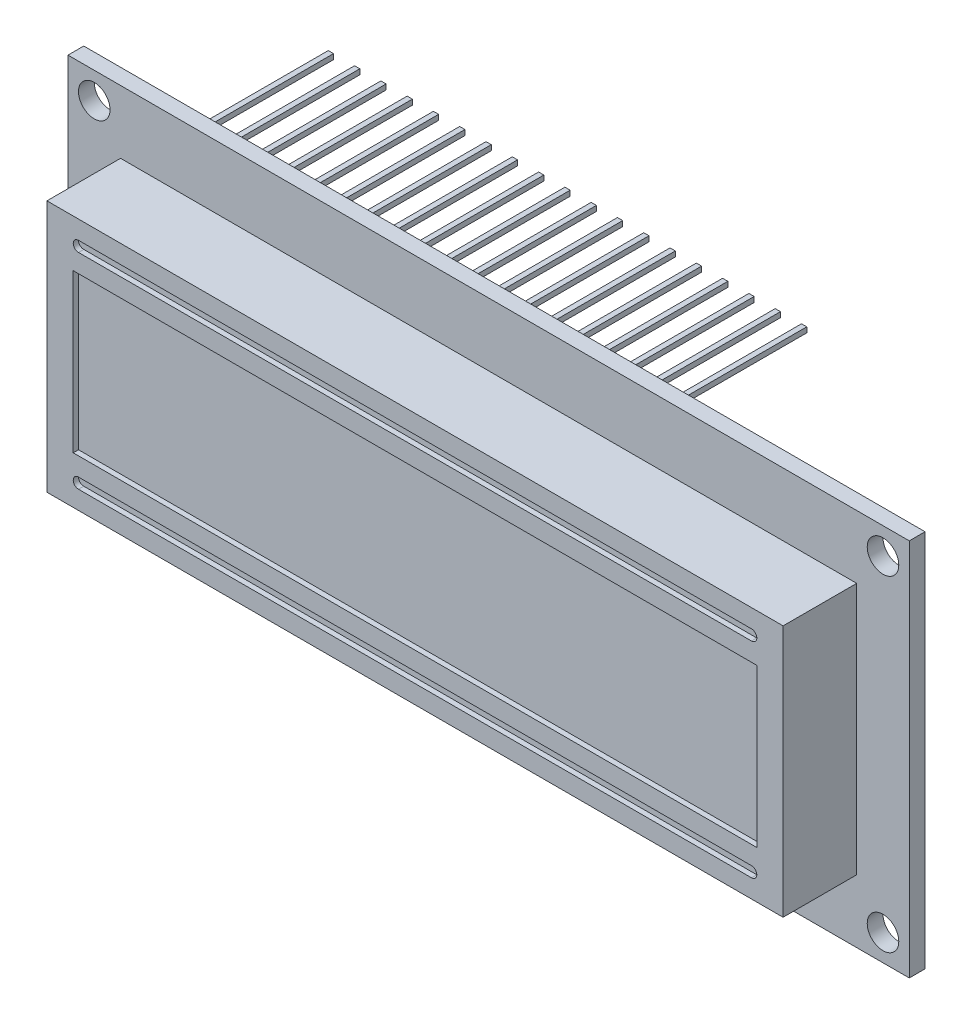
from build123d import *

# Parameters (mm, degrees)
SKETCH1_W           = 80
SKETCH1_H           = 36
BASE_FLANGE1_DEPTH  = 1.5
SKETCH6_W           = 70
SKETCH6_H           = 24
BOSS_EXTRUDE1_DEPTH = 7
SKETCH7_W           = 65
SKETCH7_H           = 15
CUT_EXTRUDE1_DEPTH  = 0.5
CUT_EXTRUDE2_DEPTH  = 0.5
CUT_EXTRUDE3_REACH  = 46.679
SKETCH9_R           = 1.5
SKETCH10_W          = 48
SKETCH10_H          = 2
BOSS_EXTRUDE2_DEPTH = 2
SKETCH11_W          = 0.5
SKETCH11_H          = 0.5
BOSS_EXTRUDE3_DEPTH = 12
LPATTERN1_COUNT     = 19
LPATTERN1_PITCH     = 2.5


# Sheet-metal steps are written as plain solids
with BuildPart() as part:
    # Sketch1 → Base-Flange1 (new body)
    with BuildSketch(Plane.XY):
        Rectangle(SKETCH1_W, SKETCH1_H)
    extrude(amount=-BASE_FLANGE1_DEPTH)

    # Sketch6 → Boss-Extrude1 (add)
    with BuildSketch(Plane.XY):
        Rectangle(SKETCH6_W, SKETCH6_H)
    extrude(amount=BOSS_EXTRUDE1_DEPTH)

    # Sketch7 → Cut-Extrude1 (cut)
    with BuildSketch(Plane.XY.offset(7)):
        Rectangle(SKETCH7_W, SKETCH7_H)
    extrude(amount=-CUT_EXTRUDE1_DEPTH, mode=Mode.SUBTRACT)

    # Sketch8 → Cut-Extrude2 (cut)
    with BuildSketch(Plane.XY.offset(7)):
        with BuildLine():
            Line((32, 9.25), (-32, 9.25))
            ThreePointArc((-32, 9.25), (-32.5, 9.75), (-32, 10.25))
            Line((-32, 10.25), (32, 10.25))
            ThreePointArc((32, 10.25), (32.5, 9.75), (32, 9.25))
        make_face()
        with BuildLine():
            Line((32, -9.25), (-32, -9.25))
            ThreePointArc((-32, -9.25), (-32.5, -9.75), (-32, -10.25))
            Line((-32, -10.25), (32, -10.25))
            ThreePointArc((32, -10.25), (32.5, -9.75), (32, -9.25))
        make_face()
    extrude(amount=-CUT_EXTRUDE2_DEPTH, mode=Mode.SUBTRACT)

    # Sketch9 → Cut-Extrude3 (cut, up to next)
    with BuildSketch(Plane(origin=(0, 0, -1.5), x_dir=(-1, 0, 0), z_dir=(0, 0, -1)), mode=Mode.PRIVATE) as cut_extrude3_sk1:
        with Locations((-37.5, 15.5)):
            Circle(SKETCH9_R)
    cut_extrude3_tool1 = extrude(cut_extrude3_sk1.sketch, amount=-CUT_EXTRUDE3_REACH, mode=Mode.PRIVATE) & part.part
    # Sketch9 → Cut-Extrude3 (cut, up to next)
    with BuildSketch(Plane(origin=(0, 0, -1.5), x_dir=(-1, 0, 0), z_dir=(0, 0, -1)), mode=Mode.PRIVATE) as cut_extrude3_sk2:
        with Locations((-37.5, -15.5)):
            Circle(SKETCH9_R)
    cut_extrude3_tool2 = extrude(cut_extrude3_sk2.sketch, amount=-CUT_EXTRUDE3_REACH, mode=Mode.PRIVATE) & part.part
    # Sketch9 → Cut-Extrude3 (cut, up to next)
    with BuildSketch(Plane(origin=(0, 0, -1.5), x_dir=(-1, 0, 0), z_dir=(0, 0, -1)), mode=Mode.PRIVATE) as cut_extrude3_sk3:
        with Locations((37.5, 15.5)):
            Circle(SKETCH9_R)
    cut_extrude3_tool3 = extrude(cut_extrude3_sk3.sketch, amount=-CUT_EXTRUDE3_REACH, mode=Mode.PRIVATE) & part.part
    # Sketch9 → Cut-Extrude3 (cut, up to next)
    with BuildSketch(Plane(origin=(0, 0, -1.5), x_dir=(-1, 0, 0), z_dir=(0, 0, -1)), mode=Mode.PRIVATE) as cut_extrude3_sk4:
        with Locations((37.5, -15.5)):
            Circle(SKETCH9_R)
    cut_extrude3_tool4 = extrude(cut_extrude3_sk4.sketch, amount=-CUT_EXTRUDE3_REACH, mode=Mode.PRIVATE) & part.part
    add(cut_extrude3_tool1.solids().sort_by_distance((37.5, 15.5, -1.5))[0], mode=Mode.SUBTRACT)
    add(cut_extrude3_tool2.solids().sort_by_distance((37.5, -15.5, -1.5))[0], mode=Mode.SUBTRACT)
    add(cut_extrude3_tool3.solids().sort_by_distance((-37.5, 15.5, -1.5))[0], mode=Mode.SUBTRACT)
    add(cut_extrude3_tool4.solids().sort_by_distance((-37.5, -15.5, -1.5))[0], mode=Mode.SUBTRACT)

    # Sketch10 → Boss-Extrude2 (add)
    with BuildSketch(Plane(origin=(0, 0, -1.5), x_dir=(-1, 0, 0), z_dir=(0, 0, -1))):
        with Locations((8, 15)):
            Rectangle(SKETCH10_W, SKETCH10_H)
    extrude(amount=BOSS_EXTRUDE2_DEPTH)

    # Sketch11 → Boss-Extrude3 (add)
    with BuildSketch(Plane(origin=(0, 0, -3.5), x_dir=(-1, 0, 0), z_dir=(0, 0, -1))):
        with Locations((30.5, 15)):
            Rectangle(SKETCH11_W, SKETCH11_H)
    boss_extrude3 = extrude(amount=BOSS_EXTRUDE3_DEPTH)

    # LPattern1: Boss-Extrude3 ×19
    with Locations(*[(i * LPATTERN1_PITCH, 0, 0) for i in range(1, LPATTERN1_COUNT)]):
        add(boss_extrude3)


solid = part.part
